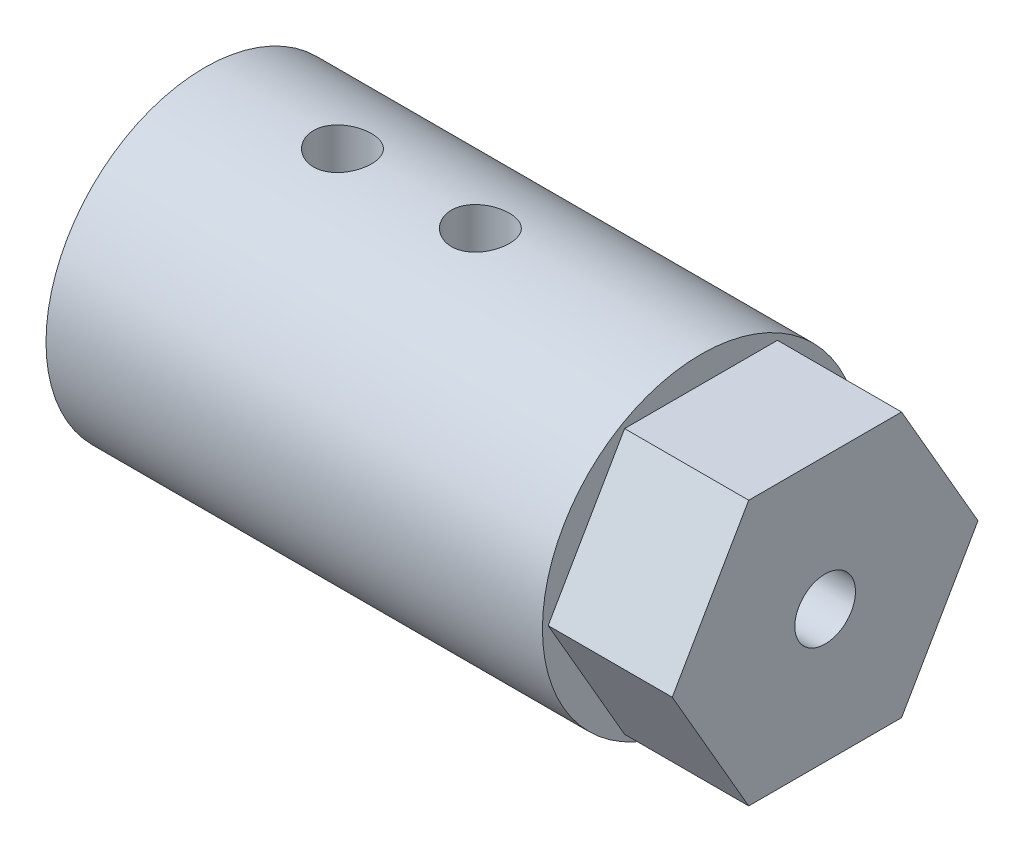
from build123d import *

# Parameters (mm, degrees)
HEX_2_DEPTH        = 5.715
SKETCH2_R          = 7.3025
SKETCH2_R_2        = 3.2766
ROTARY_SHAFT_DEPTH = 22.86
SKETCH3_R          = 1.3335
CUT_EXTRUDE1_DEPTH = 26.084509413
SKETCH4_R          = 1.397
CUT_EXTRUDE2_DEPTH = 26.084509573


with BuildPart() as part:
    # Sketch1 → Hex 2 (new body)
    with BuildSketch(Plane(origin=(0, 0, 0), x_dir=(0, 0, -1), z_dir=(1, 0, 0))):
        Polygon((-3.519527241, 6.096), (3.519527241, 6.096), (7.039054482, 0), (3.519527241, -6.096), (-3.519527241, -6.096), (-7.039054482, 0), align=None)
    extrude(amount=HEX_2_DEPTH)

    # Sketch2 → Rotary_Shaft (add)
    with BuildSketch(Plane.ZY):
        Circle(SKETCH2_R)
        Circle(SKETCH2_R_2, mode=Mode.SUBTRACT)
    extrude(amount=ROTARY_SHAFT_DEPTH)

    # Sketch3 → Cut-Extrude1 (cut, through all)
    with BuildSketch(Plane(origin=(0, 0, 0), x_dir=(1, 0, 0), z_dir=(0, 1, 0))):
        with Locations((-16.51, 0)):
            Circle(SKETCH3_R)
        with Locations((-10.16, 0)):
            Circle(SKETCH3_R)
    extrude(amount=CUT_EXTRUDE1_DEPTH, mode=Mode.SUBTRACT)

    # Sketch4 → Cut-Extrude2 (cut, through all)
    with BuildSketch(Plane.ZY):
        Circle(SKETCH4_R)
    extrude(amount=-CUT_EXTRUDE2_DEPTH, mode=Mode.SUBTRACT)


solid = part.part
